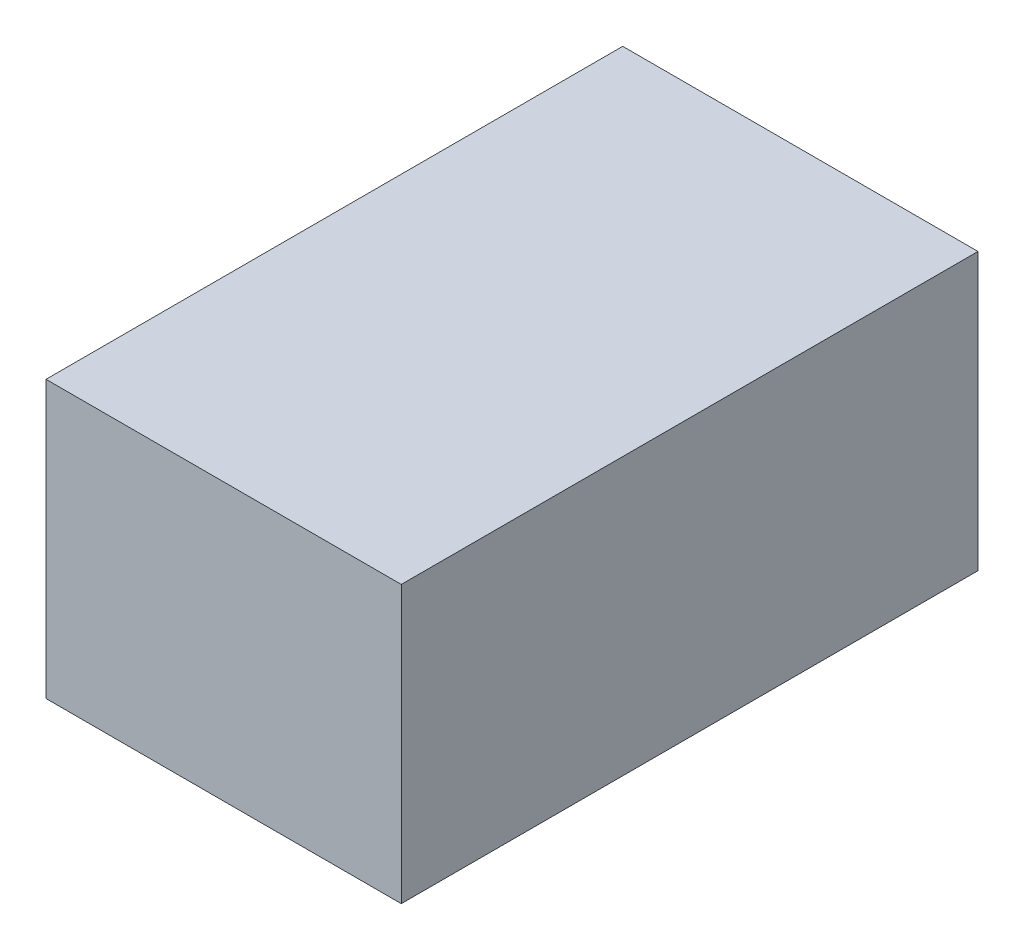
from build123d import *

# Parameters (mm, degrees)
SKETCH1_W           = 61.603248292
SKETCH1_H           = 47.942276913
BOSS_EXTRUDE1_DEPTH = 100


with BuildPart() as part:
    # Sketch1 → Boss-Extrude1 (new body)
    with BuildSketch(Plane.XY):
        with Locations((30.801624146, 23.971138457)):
            Rectangle(SKETCH1_W, SKETCH1_H)
    extrude(amount=BOSS_EXTRUDE1_DEPTH)


solid = part.part
